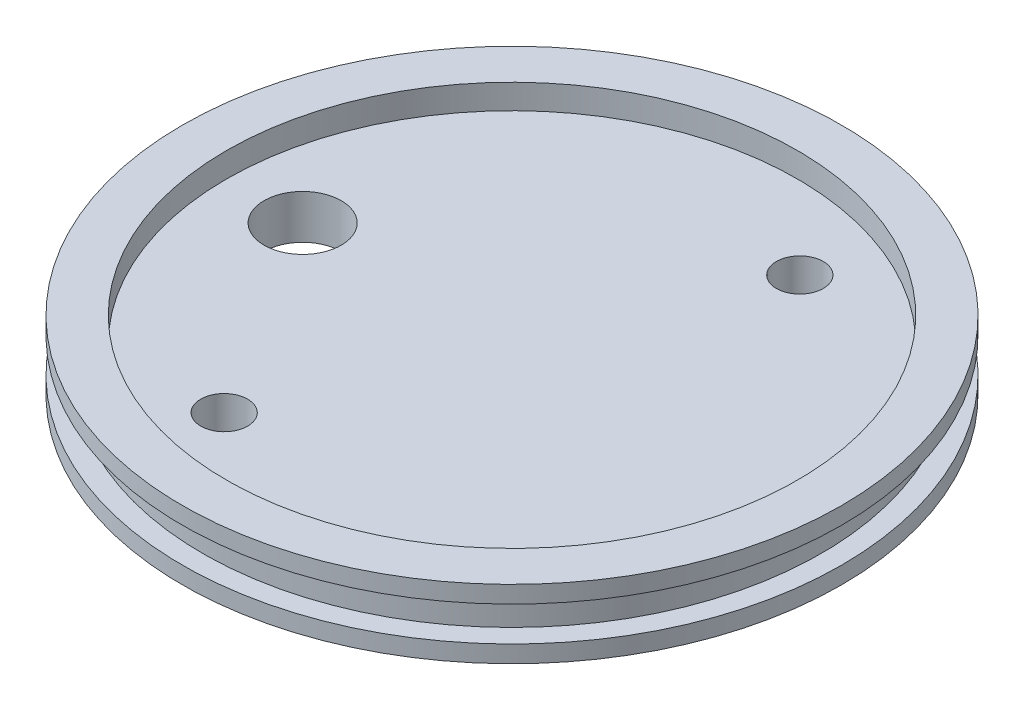
from build123d import *

# Parameters (mm, degrees)
PIPE_TAP_DRILL_FOR_1_4_TAP1_D = 11.1252
F_1_4_CLEARANCE_HOLE1_D       = 6.7564
SKETCH7_R                     = 11.1125
BOSS_EXTRUDE1_DEPTH           = 6.35


with BuildPart() as part:
    # Sketch1 → Revolve1 (revolve)
    with BuildSketch(Plane.XY):
        Polygon((0, 0), (47.498, 0), (47.498, 2.4638), (44.577, 2.4638), (44.577, 7.4422), (47.498, 7.4422), (47.498, 9.906), (41.148, 9.906), (41.148, 6.35), (0, 6.35), align=None)
    revolve(axis=Axis((0, 48.192213231, 0), (0, -1, 0)))

    # Pipe Tap Drill for 1/4 Tap1 (through all)
    with Locations(Plane(origin=(0, 6.35, 0), x_dir=(1, 0, 0), z_dir=(0, 1, 0))):
        with Locations((0, 0), (-30.1752, 0)):
            Hole(PIPE_TAP_DRILL_FOR_1_4_TAP1_D / 2)

    # 1/4 Clearance Hole1 (through all)
    with Locations(Plane(origin=(0, 6.35, 0), x_dir=(1, 0, 0), z_dir=(0, 1, 0))):
        with Locations((12.150198978, 29.333175157), (-12.150198978, -29.333175157)):
            Hole(F_1_4_CLEARANCE_HOLE1_D / 2)

    # Sketch7 → Boss-Extrude1 (add)
    with BuildSketch(Plane(origin=(0, 6.35, 0), x_dir=(1, 0, 0), z_dir=(0, 1, 0))):
        Circle(SKETCH7_R)
    extrude(amount=-BOSS_EXTRUDE1_DEPTH)


solid = part.part
